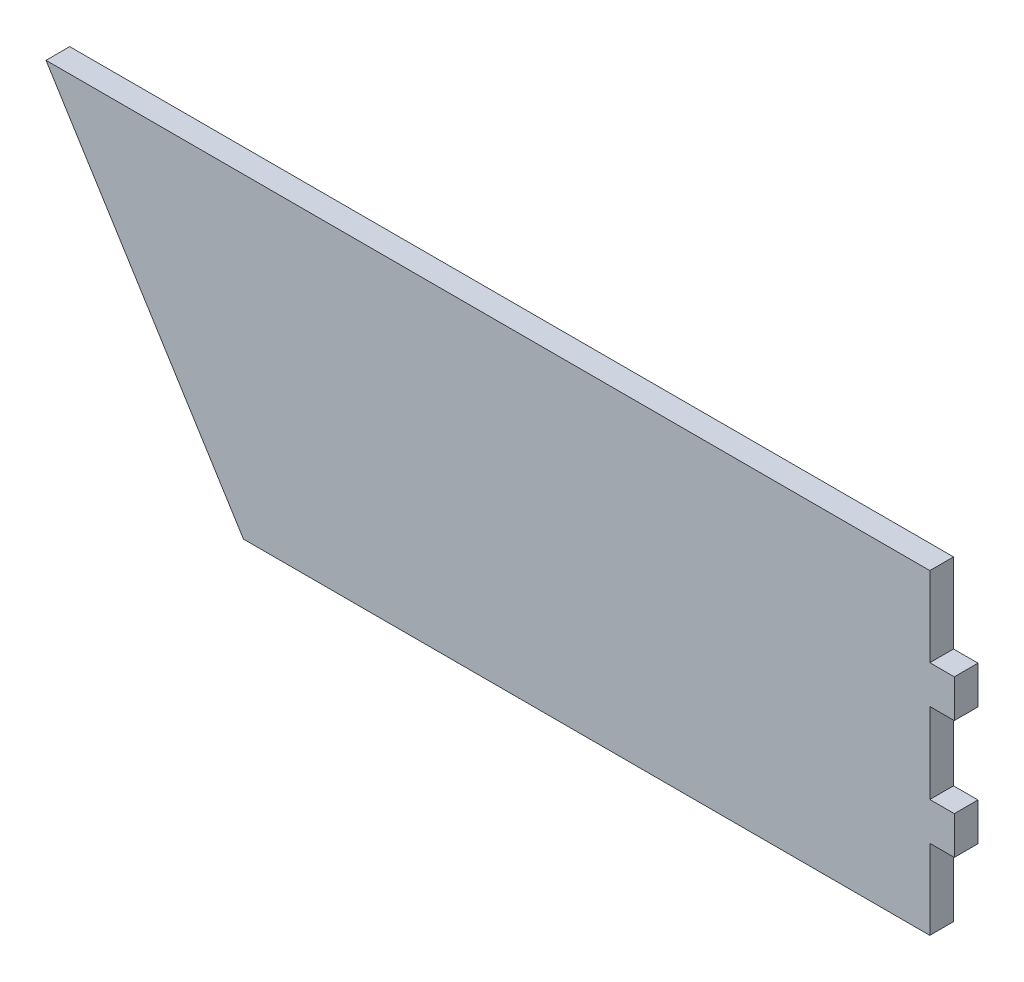
from build123d import *

# Parameters (mm, degrees)
T_LE_DE_BASE_PLI_E1_DEPTH              = 3
TENON_START                            = 14.9
TENON_ET_MORTAISE_RAINURE1_OUTLINE_W   = 3.1
TENON_ET_MORTAISE_RAINURE1_OUTLINE_H   = 3
TENON_ET_MORTAISE_RAINURE1_DEPTH       = 10.2
TENON_ET_MORTAISE_RAINURE1_2_OUTLINE_W = 3.1
TENON_ET_MORTAISE_RAINURE1_2_OUTLINE_H = 3
TENON_ET_MORTAISE_RAINURE1_2_DEPTH     = 10.1
TENON_START_2                          = 29.9
TENON_ET_MORTAISE_RAINURE1_3_OUTLINE_W = 3.1
TENON_ET_MORTAISE_RAINURE1_3_OUTLINE_H = 3
TENON_ET_MORTAISE_RAINURE1_3_DEPTH     = 10.1


# Read off the part's stored shape, not the designer's step: Tenon et mortaise-Rainure1
# Sheet-metal steps are written as plain solids
with BuildPart() as part:
    # Esquisse1 → Tôle de base pliée1 (new body)
    with BuildSketch(Plane.XY):
        Polygon((25, 0), (115, 0), (115, 40), (0, 40), align=None)
    extrude(amount=T_LE_DE_BASE_PLI_E1_DEPTH)

    # Tenon et mortaise-Rainure1 outline → Tenon et mortaise-Rainure1 (cut)
    with BuildSketch(Plane(origin=(0, 0, 0), x_dir=(1, 0, 0), z_dir=(0, 1, 0)).offset(TENON_START)):
        with Locations((113.45, -1.5)):
            Rectangle(TENON_ET_MORTAISE_RAINURE1_OUTLINE_W, TENON_ET_MORTAISE_RAINURE1_OUTLINE_H)
    extrude(amount=TENON_ET_MORTAISE_RAINURE1_DEPTH, mode=Mode.SUBTRACT)

    # Tenon et mortaise-Rainure1 2 outline → Tenon et mortaise-Rainure1 2 (cut)
    with BuildSketch(Plane(origin=(0, 0, 0), x_dir=(1, 0, 0), z_dir=(0, 1, 0))):
        with Locations((113.45, -1.5)):
            Rectangle(TENON_ET_MORTAISE_RAINURE1_2_OUTLINE_W, TENON_ET_MORTAISE_RAINURE1_2_OUTLINE_H)
    extrude(amount=TENON_ET_MORTAISE_RAINURE1_2_DEPTH, mode=Mode.SUBTRACT)

    # Tenon et mortaise-Rainure1 3 outline → Tenon et mortaise-Rainure1 3 (cut)
    with BuildSketch(Plane(origin=(0, 0, 0), x_dir=(1, 0, 0), z_dir=(0, 1, 0)).offset(TENON_START_2)):
        with Locations((113.45, -1.5)):
            Rectangle(TENON_ET_MORTAISE_RAINURE1_3_OUTLINE_W, TENON_ET_MORTAISE_RAINURE1_3_OUTLINE_H)
    extrude(amount=TENON_ET_MORTAISE_RAINURE1_3_DEPTH, mode=Mode.SUBTRACT)


solid = part.part
